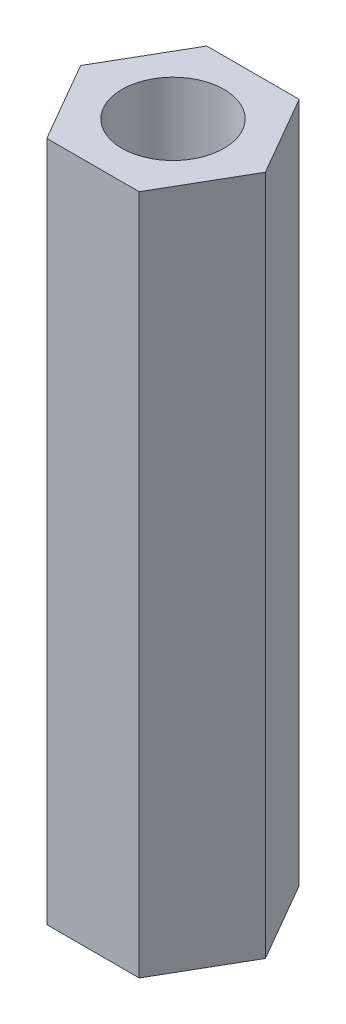
from build123d import *

# Parameters (mm, degrees)
SKETCH1_R           = 1.5
BOSS_EXTRUDE1_DEPTH = 20


with BuildPart() as part:
    # Sketch1 → Boss-Extrude1 (new body)
    with BuildSketch(Plane(origin=(0, 0, 0), x_dir=(1, 0, 0), z_dir=(0, 1, 0))):
        Polygon((2.713546265, 0), (1.356773133, 2.35), (-1.356773133, 2.35), (-2.713546265, 0), (-1.356773133, -2.35), (1.356773133, -2.35), align=None)
        Circle(SKETCH1_R, mode=Mode.SUBTRACT)
    extrude(amount=BOSS_EXTRUDE1_DEPTH)


solid = part.part
